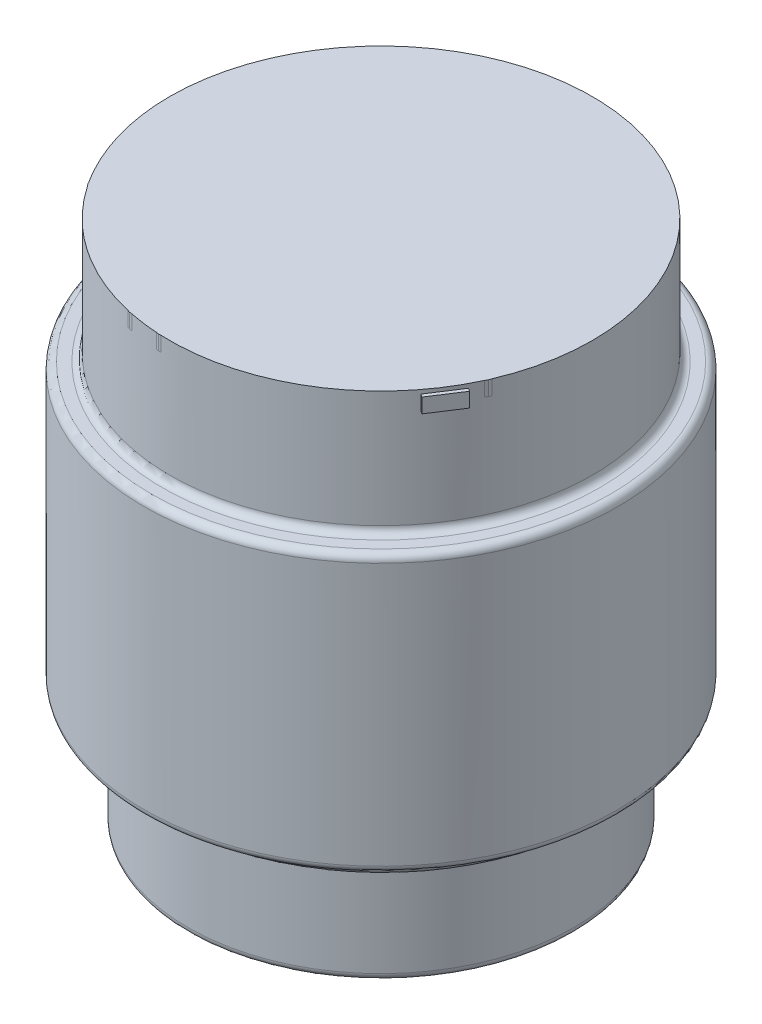
from build123d import *

# Parameters (mm, degrees)
BOSS_EXTRUDE4_DEPTH = 2
FILLET6_R           = 1
FILLET7_R           = 1


with BuildPart() as part:
    # Sketch10 → Revolve-Thin6 (revolve)
    with BuildSketch(Plane.XY, mode=Mode.PRIVATE) as revolve_thin6_sk:
        Polygon((0, 6.496951367), (29, 6.496951367), (29, -10.503048633), (32.5, -10.503048633), (32.5, -48.503048633), (30, -48.503048633), (30, -50.503048633), (26.5, -50.503048633), (26.5, -65.503048633), (0, -65.503048633), (0, -55.503048633), (16.5, -55.503048633), (16.5, -40.503048633), (20, -40.503048633), (20, -38.503048633), (22.5, -38.503048633), (22.5, -20.503048633), (19, -20.503048633), (19, -3.503048633), (0, -3.503048633), align=None)
    revolve(revolve_thin6_sk.sketch.rotate(Axis((0, 6.496951367, 0), (0, -1, 0)), 180), axis=Axis((0, 6.496951367, 0), (0, -1, 0)))

    # Sketch11 → Boss-Extrude4 (add)
    # profile 1 of 17: a face of its own
    with BuildSketch(Plane(origin=(0, 6.496951367, 0), x_dir=(1, 0, 0), z_dir=(0, 1, 0))):
        with BuildLine():
            Line((-28.957681113, -0.532634273), (-23.727650336, -0.121119574))
            Line((-23.727650336, -0.121119574), (-23.676575817, -0.774873421))
            Line((-23.676575817, -0.774873421), (-24.419345255, -0.833244301))
            add(Edge.make_bspline(
                [(-24.419345255, -0.833244301), (-24.347458268, -0.868124694), (-24.208276372, -0.935657353), (-24.019720789, -1.060296367), (-23.858401964, -1.201963839), (-23.723445217, -1.358733852), (-23.613134348, -1.530208931), (-23.531771043, -1.717095845), (-23.474722199, -1.918489433), (-23.458634658, -2.058679701), (-23.45038866, -2.130537091)],
                knots=[0, 0, 0, 0, 1.122070881, 2.172464881, 3.165406667, 4.130083354, 5.070697886, 6.019548718, 6.984879185, 8, 8, 8, 8], degree=3))
            add(Edge.make_bspline(
                [(-23.45038866, -2.130537091), (-23.447617405, -2.187461573), (-23.442162047, -2.299520383), (-23.456671681, -2.465257338), (-23.484753308, -2.626195577), (-23.533725182, -2.779164234), (-23.594319148, -2.923543369), (-23.667725352, -3.056509777), (-23.753649104, -3.175856004), (-23.851508052, -3.283307733), (-23.964295992, -3.37806856), (-24.094363282, -3.460985401), (-24.240553005, -3.535793448), (-24.376340765, -3.587421592), (-24.496622371, -3.623403309), (-24.59979189, -3.649823706), (-24.714592251, -3.674614535), (-24.84228026, -3.696025746), (-24.981461665, -3.716219029), (-25.13276416, -3.73518713), (-25.295674109, -3.753025938), (-25.408702825, -3.761831381), (-25.467102536, -3.766380981)],
                knots=[0, 0, 0, 0, 1.148046011, 2.259988374, 3.347033514, 4.436024228, 5.490905377, 6.50081764, 7.491734499, 8.449821394, 9.424436832, 10.452900198, 11.554016567, 12.730826635, 13.376294553, 14.085271799, 14.877932457, 15.743918541, 16.695556315, 17.713912727, 18.818823728, 20, 20, 20, 20], degree=3))
            Line((-25.467102536, -3.766380981), (-28.68333798, -4.018835033))
            Line((-28.68333798, -4.018835033), (-28.74170886, -3.290658315))
            Line((-28.74170886, -3.290658315), (-25.560495943, -3.039663534))
            add(Edge.make_bspline(
                [(-25.560495943, -3.039663534), (-25.470882011, -3.031425764), (-25.304250198, -3.016108118), (-25.074952999, -2.980446954), (-24.885153557, -2.936547585), (-24.730338419, -2.882819593), (-24.604729904, -2.813829942), (-24.496731112, -2.736182256), (-24.408420301, -2.641630597), (-24.334762754, -2.538047074), (-24.278539771, -2.423912271), (-24.244262473, -2.300708132), (-24.225436231, -2.17145415), (-24.229189445, -2.083404639), (-24.231099169, -2.038602956)],
                knots=[0, 0, 0, 0, 1.709897918, 3.179454152, 4.405848744, 5.40882994, 6.281571251, 7.120924061, 7.925132213, 8.727851484, 9.529878548, 10.328542577, 11.149522752, 12, 12, 12, 12], degree=3))
            add(Edge.make_bspline(
                [(-24.231099169, -2.038602956), (-24.235555063, -1.996148523), (-24.244287979, -1.912943884), (-24.272268245, -1.792987509), (-24.311899035, -1.680888821), (-24.363170897, -1.57642722), (-24.426583712, -1.479996193), (-24.499959173, -1.389496534), (-24.586522881, -1.307925031), (-24.685331275, -1.234366405), (-24.797842059, -1.168932068), (-24.927322265, -1.11518988), (-25.073366562, -1.073664677), (-25.235612364, -1.043558796), (-25.414058166, -1.023070965), (-25.60953906, -1.015595477), (-25.82143582, -1.01638012), (-25.96766739, -1.026471223), (-26.043514968, -1.03170529)],
                knots=[0, 0, 0, 0, 0.870478611, 1.706014023, 2.506619552, 3.292379936, 4.074306248, 4.857240034, 5.664708371, 6.494563828, 7.366286708, 8.313887945, 9.34743346, 10.459065403, 11.678042666, 13.009522691, 14.4488954, 16, 16, 16, 16], degree=3))
            Line((-26.043514968, -1.03170529), (-28.900769505, -1.256433175))
            Line((-28.900769505, -1.256433175), (-28.957681113, -0.532634273))
        make_face()
    # profile 2 of 17: a face of its own
    with BuildSketch(Plane(origin=(0, 6.496951367, 0), x_dir=(1, 0, 0), z_dir=(0, 1, 0))):
        Polygon((-22.453978986, -3.908394348), (-21.452918408, -3.714311175), (-21.315746842, -4.424976629), (-22.31680742, -4.619059802), align=None)
    # profile 3 of 17: a face of its own
    with BuildSketch(Plane(origin=(0, 6.496951367, 0), x_dir=(1, 0, 0), z_dir=(0, 1, 0))):
        Polygon((-28.539143143, -5.078730476), (-23.405424317, -4.090803346), (-23.268252751, -4.8014688), (-28.401971577, -5.78939593), align=None)
    # profile 4 of 17: a face of its own
    with BuildSketch(Plane(origin=(0, 6.496951367, 0), x_dir=(1, 0, 0), z_dir=(0, 1, 0))):
        Polygon((-28.12835516, -6.916015215), (-21.242050686, -4.836552644), (-21.033374793, -5.52678829), (-24.960275691, -6.71317641), (-22.435735166, -7.743422428), (-22.164310577, -8.640874696), (-24.48747157, -7.635436301), (-27.105405502, -10.301526209), (-27.36223737, -9.452229917), (-25.221485376, -7.323152098), (-25.942365734, -7.009408622), (-27.919679267, -7.606250862), align=None)
    # profile 5 of 17: a face of its own
    with BuildSketch(Plane(origin=(0, 6.496951367, 0), x_dir=(1, 0, 0), z_dir=(0, 1, 0))):
        Polygon((-26.869487414, -10.820804792), (-20.317356224, -7.778222713), (-20.01236838, -8.434895104), (-23.749563921, -10.169969488), (-21.092229645, -10.838316055), (-20.696766938, -11.691990164), (-23.146884593, -11.020725053), (-25.373733634, -14.042877323), (-25.748766533, -13.234440647), (-23.921758014, -10.816426976), (-24.683497988, -10.604832538), (-26.56449957, -11.477477183), align=None)
    # profile 6 of 17: a face of its own
    with BuildSketch(Plane(origin=(0, 6.496951367, 0), x_dir=(1, 0, 0), z_dir=(0, 1, 0))):
        with BuildLine():
            add(Edge.make_bspline(
                [(-23.049394948, -12.819651907), (-22.957207269, -12.760566839), (-22.778315034, -12.645910954), (-22.506409131, -12.498932132), (-22.242850071, -12.37587258), (-21.986040202, -12.281070562), (-21.736970357, -12.210509389), (-21.495185768, -12.170061136), (-21.261019124, -12.152538824), (-21.034825435, -12.163006115), (-20.819037221, -12.197148296), (-20.614562749, -12.248759077), (-20.423710347, -12.322991577), (-20.243692141, -12.414272055), (-20.07909054, -12.529660901), (-19.925515825, -12.661670815), (-19.785569867, -12.814735974), (-19.704982944, -12.929128487), (-19.663883954, -12.987468184)],
                knots=[0, 0, 0, 0, 1.377928271, 2.67390037, 3.887587296, 5.036398565, 6.116374832, 7.141129695, 8.117029299, 9.067076788, 9.984172926, 10.863365319, 11.716214135, 12.556953573, 13.397693011, 14.239836003, 15.102323811, 16, 16, 16, 16], degree=3))
            add(Edge.make_bspline(
                [(-19.663883954, -12.987468184), (-19.627054489, -13.047053668), (-19.55448975, -13.164454374), (-19.469747432, -13.351044815), (-19.407567119, -13.541896523), (-19.369774411, -13.737980118), (-19.353414617, -13.938155013), (-19.361086115, -14.14332841), (-19.39282937, -14.352368052), (-19.444672757, -14.565497685), (-19.521996301, -14.778049965), (-19.625320298, -14.987724076), (-19.756402891, -15.191599065), (-19.911485215, -15.391976792), (-20.093079628, -15.587295013), (-20.300294602, -15.777552452), (-20.533715297, -15.963844694), (-20.702130719, -16.079732336), (-20.78898265, -16.139495661)],
                knots=[0, 0, 0, 0, 0.894306785, 1.762044052, 2.611129252, 3.453385758, 4.307596222, 5.172055421, 6.070348654, 7.004932772, 7.970277812, 8.954230234, 9.985283289, 11.061861841, 12.187775178, 13.38851473, 14.653255514, 16, 16, 16, 16], degree=3))
            add(Edge.make_bspline(
                [(-20.78898265, -16.139495661), (-20.884556491, -16.201034867), (-21.069654471, -16.320217925), (-21.350262956, -16.473179399), (-21.621403855, -16.60043503), (-21.883976553, -16.699538477), (-22.137577196, -16.775081471), (-22.383422148, -16.818444197), (-22.620070007, -16.836995438), (-22.846902509, -16.828791557), (-23.062134127, -16.793852957), (-23.266053276, -16.74238758), (-23.457498734, -16.668704137), (-23.636037511, -16.574916465), (-23.802658301, -16.462016403), (-23.955076037, -16.327412506), (-24.09629038, -16.174284437), (-24.177206663, -16.05924667), (-24.218271804, -16.000864823)],
                knots=[0, 0, 0, 0, 1.410864862, 2.7324238, 3.96446408, 5.126475298, 6.213990734, 7.244600286, 8.219584348, 9.156338201, 10.054879087, 10.922003448, 11.763145832, 12.595133244, 13.420916799, 14.255464616, 15.114645557, 16, 16, 16, 16], degree=3))
            add(Edge.make_bspline(
                [(-24.218271804, -16.000864823), (-24.255829205, -15.940904779), (-24.329377987, -15.82348483), (-24.411893658, -15.634754606), (-24.476631504, -15.443832307), (-24.513293917, -15.246875369), (-24.530959252, -15.046250128), (-24.520073317, -14.841777167), (-24.491671277, -14.632231593), (-24.437138857, -14.419893274), (-24.358345134, -14.206271701), (-24.252588786, -13.995103382), (-24.118564099, -13.788502311), (-23.956414366, -13.586960444), (-23.768673974, -13.38831778), (-23.554941515, -13.192363914), (-23.313335499, -13.00121167), (-23.139141143, -12.881386634), (-23.049394948, -12.819651907)],
                knots=[0, 0, 0, 0, 0.890528789, 1.743925415, 2.589179939, 3.425988632, 4.262460414, 5.121519344, 6.00064356, 6.923992462, 7.87830598, 8.865298687, 9.894092142, 10.975983473, 12.120928627, 13.335821418, 14.627395881, 16, 16, 16, 16], degree=3))
        make_face()
        with BuildLine():
            add(Edge.make_bspline(
                [(-22.639339521, -13.439842498), (-22.706978311, -13.485823378), (-22.837713804, -13.574697427), (-23.019414664, -13.715553985), (-23.182026023, -13.856496285), (-23.323978222, -13.99946743), (-23.445690424, -14.143101102), (-23.549469478, -14.286082798), (-23.631262613, -14.431350152), (-23.695070935, -14.575944669), (-23.737912287, -14.720008536), (-23.768438087, -14.859399979), (-23.78025135, -14.995722519), (-23.775567425, -15.127889207), (-23.757057468, -15.256901947), (-23.72190084, -15.382263748), (-23.668844335, -15.502573517), (-23.6227997, -15.577678246), (-23.599540484, -15.615617021)],
                knots=[0, 0, 0, 0, 1.476279224, 2.853423223, 4.147953738, 5.358852271, 6.486652708, 7.544264598, 8.543112169, 9.490974778, 10.391010581, 11.252162267, 12.063134575, 12.853933517, 13.635116927, 14.410752231, 15.197199508, 16, 16, 16, 16], degree=3))
            add(Edge.make_bspline(
                [(-23.599540484, -15.615617021), (-23.575175573, -15.64994561), (-23.52708069, -15.7177082), (-23.439079227, -15.805501432), (-23.342471145, -15.882880666), (-23.233442064, -15.944814612), (-23.11528413, -15.996784586), (-22.986059793, -16.036208766), (-22.846026158, -16.061820687), (-22.696567058, -16.074806071), (-22.538483787, -16.074155132), (-22.372899861, -16.05223749), (-22.200272418, -16.01456881), (-22.02165848, -15.956210551), (-21.83607465, -15.881316049), (-21.643278274, -15.789268125), (-21.444166668, -15.677737613), (-21.312396353, -15.592536589), (-21.244275508, -15.548490509)],
                knots=[0, 0, 0, 0, 0.76969777, 1.51933754, 2.267864889, 3.03031097, 3.808213611, 4.62823263, 5.498353348, 6.410552238, 7.372713114, 8.387071871, 9.463491849, 10.604512329, 11.823710242, 13.126700497, 14.514600267, 16, 16, 16, 16], degree=3))
            add(Edge.make_bspline(
                [(-21.244275508, -15.548490509), (-21.177175336, -15.502436421), (-21.047174114, -15.413210303), (-20.865582534, -15.272874389), (-20.703482439, -15.131865735), (-20.561275752, -14.990257237), (-20.438772014, -14.848491955), (-20.337295715, -14.704654801), (-20.255184679, -14.559968074), (-20.19146568, -14.415289539), (-20.148684021, -14.271250223), (-20.117754432, -14.131365618), (-20.107060416, -13.994607042), (-20.108329265, -13.862185409), (-20.130323294, -13.734056985), (-20.164390107, -13.608935898), (-20.218088799, -13.488400513), (-20.26379644, -13.412629224), (-20.286993089, -13.374175259)],
                knots=[0, 0, 0, 0, 1.47058857, 2.849147881, 4.145008804, 5.35091982, 6.473185514, 7.526799061, 8.526673163, 9.475509904, 10.376470686, 11.238507391, 12.059071255, 12.850438821, 13.625077647, 14.401510082, 15.188765603, 16, 16, 16, 16], degree=3))
            add(Edge.make_bspline(
                [(-20.286993089, -13.374175259), (-20.311341807, -13.339823506), (-20.359803255, -13.271452936), (-20.44888334, -13.183410924), (-20.544996064, -13.103816145), (-20.65462343, -13.042153446), (-20.772684795, -12.990044717), (-20.901494296, -12.950888279), (-21.040960811, -12.924887667), (-21.189972497, -12.912115593), (-21.347567535, -12.912654939), (-21.512191831, -12.934623993), (-21.683784536, -12.972518749), (-21.861916671, -13.030732718), (-22.047924941, -13.105248097), (-22.239927671, -13.199428089), (-22.439510741, -13.310466083), (-22.571239934, -13.395752351), (-22.639339521, -13.439842498)],
                knots=[0, 0, 0, 0, 0.769904061, 1.532346229, 2.286621382, 3.049271811, 3.827382942, 4.647621739, 5.50921895, 6.421662323, 7.384081074, 8.389869001, 9.457877035, 10.599203326, 11.818728004, 13.125930407, 14.514202156, 16, 16, 16, 16], degree=3))
        make_face(mode=Mode.SUBTRACT)
    # profile 7 of 17: a face of its own
    with BuildSketch(Plane(origin=(0, 6.496951367, 0), x_dir=(1, 0, 0), z_dir=(0, 1, 0))):
        with BuildLine():
            Line((-22.503680055, -18.260097003), (-18.533000998, -14.843941297))
            Line((-18.533000998, -14.843941297), (-18.103975036, -15.341553043))
            Line((-18.103975036, -15.341553043), (-18.705195091, -15.859594596))
            add(Edge.make_bspline(
                [(-18.705195091, -15.859594596), (-18.658597984, -15.846092766), (-18.568709499, -15.820046964), (-18.437534356, -15.788430611), (-18.316387692, -15.762219898), (-18.20526771, -15.740333885), (-18.103189936, -15.729374254), (-18.010699068, -15.72319228), (-17.927693014, -15.722230369), (-17.830946816, -15.732242172), (-17.721544017, -15.757387242), (-17.601883803, -15.807914135), (-17.494765808, -15.878226076), (-17.436014279, -15.939605383), (-17.406443029, -15.970499266)],
                knots=[0, 0, 0, 0, 1.261029181, 2.432597441, 3.506539149, 4.483737313, 5.374657151, 6.172903435, 6.893674923, 7.529084029, 8.697714225, 9.796893971, 10.891116522, 12, 12, 12, 12], degree=3))
            add(Edge.make_bspline(
                [(-17.406443029, -15.970499266), (-17.368796023, -16.019288007), (-17.291513671, -16.119442283), (-17.213743933, -16.300125265), (-17.15824716, -16.502554844), (-17.144905533, -16.64672298), (-17.137936985, -16.722024336)],
                knots=[0, 0, 0, 0, 0.907858786, 1.863666438, 2.884158329, 4, 4, 4, 4], degree=3))
            Line((-17.137936985, -16.722024336), (-17.92302531, -17.072249611))
            add(Edge.make_bspline(
                [(-17.92302531, -17.072249611), (-17.929902794, -17.019445012), (-17.943070865, -16.918341952), (-17.984200256, -16.77660516), (-18.041709062, -16.651363559), (-18.095368004, -16.581108226), (-18.121486299, -16.546911698)],
                knots=[0, 0, 0, 0, 1.119608421, 2.14367383, 3.096439983, 4, 4, 4, 4], degree=3))
            add(Edge.make_bspline(
                [(-18.121486299, -16.546911698), (-18.14769108, -16.518975893), (-18.199914964, -16.463302226), (-18.297200478, -16.400634675), (-18.405296089, -16.354787471), (-18.523776935, -16.327517991), (-18.649366875, -16.318758256), (-18.779466176, -16.330730428), (-18.912197478, -16.364961391), (-18.997990281, -16.402191576), (-19.042286919, -16.421414308)],
                knots=[0, 0, 0, 0, 0.915944099, 1.825398144, 2.750881659, 3.721747369, 4.72774328, 5.758872911, 6.842858727, 8, 8, 8, 8], degree=3))
            add(Edge.make_bspline(
                [(-19.042286919, -16.421414308), (-19.121171209, -16.461229715), (-19.28036575, -16.541580257), (-19.510968257, -16.682623874), (-19.736303002, -16.841489957), (-19.879204294, -16.959888281), (-19.951413362, -17.01971582)],
                knots=[0, 0, 0, 0, 0.971274388, 1.960106118, 2.969226699, 4, 4, 4, 4], degree=3))
            Line((-19.951413362, -17.01971582), (-22.030875934, -18.808783267))
            Line((-22.030875934, -18.808783267), (-22.503680055, -18.260097003))
        make_face()
    # profile 8 of 17: a face of its own
    with BuildSketch(Plane(origin=(0, 6.496951367, 0), x_dir=(1, 0, 0), z_dir=(0, 1, 0))):
        Polygon((-19.423254639, -21.535299467), (-13.268045428, -17.080142112), (-12.589483957, -17.585050217), (-14.960800924, -24.850765406), (-15.683140555, -24.315212589), (-14.928696941, -22.140897339), (-16.920603194, -20.661195551), (-18.753448801, -22.032911212), align=None)
        with BuildLine():
            Line((-16.272686434, -20.169420894), (-14.657272353, -21.368942462))
            Line((-14.657272353, -21.368942462), (-13.95536253, -19.390169657))
            add(Edge.make_bspline(
                [(-13.95536253, -19.390169657), (-13.929241263, -19.315694703), (-13.878471588, -19.170944103), (-13.801809057, -18.960114576), (-13.729612485, -18.76021359), (-13.658114725, -18.572617163), (-13.589049242, -18.396713057), (-13.523602153, -18.232213632), (-13.46137497, -18.078548598), (-13.418566763, -17.980907775), (-13.397920634, -17.93381622)],
                knots=[0, 0, 0, 0, 1.21438178, 2.360290057, 3.451842455, 4.484668862, 5.449258951, 6.359620403, 7.208855247, 8, 8, 8, 8], degree=3))
            add(Edge.make_bspline(
                [(-13.397920634, -17.93381622), (-13.482914341, -18.014752688), (-13.653547696, -18.177240729), (-13.921235372, -18.409178258), (-14.195357325, -18.63711016), (-14.385280861, -18.780910676), (-14.480700443, -18.853157568)],
                knots=[0, 0, 0, 0, 0.990747883, 1.989025307, 2.989665162, 4, 4, 4, 4], degree=3))
            Line((-14.480700443, -18.853157568), (-16.272686434, -20.169420894))
        make_face(mode=Mode.SUBTRACT)
    # profile 9 of 17: a face of its own
    with BuildSketch(Plane(origin=(0, 6.496951367, 0), x_dir=(1, 0, 0), z_dir=(0, 1, 0))):
        Polygon((-14.375966207, -25.126353217), (-11.185997658, -18.641348538), (-7.597647859, -20.407067634), (-7.97414003, -21.173185423), (-10.859120735, -19.753313787), (-11.847047865, -21.761272031), (-9.35169278, -22.988519766), (-9.72818495, -23.753178284), (-12.223540036, -22.525930549), (-13.672597112, -25.472200676), align=None)
    # profile 10 of 17: a face of its own
    with BuildSketch(Plane(origin=(0, 6.496951367, 0), x_dir=(1, 0, 0), z_dir=(0, 1, 0))):
        with BuildLine():
            Line((-7.549456327, -26.008970702), (-6.784797809, -26.090689933))
            add(Edge.make_bspline(
                [(-6.784797809, -26.090689933), (-6.788324413, -26.147090737), (-6.795190746, -26.256903663), (-6.795119602, -26.417218266), (-6.786481707, -26.568264847), (-6.769870248, -26.709923589), (-6.741705639, -26.842045139), (-6.705406648, -26.965132501), (-6.660533068, -27.079220597), (-6.606430009, -27.183242077), (-6.544456813, -27.276915355), (-6.47784577, -27.362160363), (-6.404031653, -27.436462863), (-6.326831327, -27.503191523), (-6.24326997, -27.55863865), (-6.154539349, -27.604118982), (-6.060964882, -27.641599623), (-5.99509169, -27.65730136), (-5.961768413, -27.665244399)],
                knots=[0, 0, 0, 0, 1.389716794, 2.705792356, 3.940206737, 5.109593109, 6.210115764, 7.258684784, 8.262904256, 9.220797597, 10.136674164, 11.022357389, 11.876864736, 12.708707921, 13.528329561, 14.336342241, 15.158405313, 16, 16, 16, 16], degree=3))
            add(Edge.make_bspline(
                [(-5.961768413, -27.665244399), (-5.919569989, -27.672562734), (-5.836570537, -27.686957058), (-5.710527266, -27.691211138), (-5.58592105, -27.679640989), (-5.462680676, -27.651119372), (-5.340525818, -27.608727568), (-5.220224289, -27.549615288), (-5.102062397, -27.474364009), (-4.98548792, -27.385499286), (-4.873320355, -27.283043154), (-4.771210743, -27.164442322), (-4.675241205, -27.034718455), (-4.591944396, -26.890066471), (-4.516420176, -26.733640418), (-4.451493493, -26.564042092), (-4.394129536, -26.381325309), (-4.364484527, -26.253864652), (-4.349272875, -26.188461155)],
                knots=[0, 0, 0, 0, 0.844313363, 1.660667415, 2.480118955, 3.306734256, 4.150611056, 5.026311028, 5.945033722, 6.910642073, 7.91593497, 8.936236463, 9.994042251, 11.095327271, 12.224369721, 13.418602001, 14.675415133, 16, 16, 16, 16], degree=3))
            add(Edge.make_bspline(
                [(-4.349272875, -26.188461155), (-4.337291403, -26.126822512), (-4.313910075, -26.00653734), (-4.293057302, -25.829014191), (-4.287878474, -25.659252684), (-4.292145234, -25.498058476), (-4.313232855, -25.344711214), (-4.346389685, -25.199937647), (-4.393077063, -25.063319331), (-4.453208, -24.936604504), (-4.523333937, -24.819105698), (-4.603129543, -24.71295209), (-4.691517194, -24.618902988), (-4.787074946, -24.535530352), (-4.892651095, -24.466160711), (-5.005592705, -24.406680979), (-5.128085252, -24.361573193), (-5.21342528, -24.340231006), (-5.256940046, -24.329348653)],
                knots=[0, 0, 0, 0, 1.297623625, 2.532256924, 3.68916195, 4.805876302, 5.860919924, 6.882770692, 7.871592211, 8.838551481, 9.776538345, 10.695472832, 11.57747539, 12.440067982, 13.310069946, 14.182450474, 15.073233932, 16, 16, 16, 16], degree=3))
            add(Edge.make_bspline(
                [(-5.256940046, -24.329348653), (-5.310769625, -24.320622092), (-5.417943909, -24.303247575), (-5.581601319, -24.302698122), (-5.744205138, -24.331218678), (-5.904978362, -24.37825394), (-6.060523688, -24.448514024), (-6.205368539, -24.541456556), (-6.340573989, -24.654312439), (-6.417337566, -24.74450845), (-6.456461614, -24.790478598)],
                knots=[0, 0, 0, 0, 0.966538294, 1.924370427, 2.886197827, 3.885463141, 4.889560341, 5.902149781, 6.93078991, 8, 8, 8, 8], degree=3))
            Line((-6.456461614, -24.790478598), (-7.105837645, -24.54094309))
            Line((-7.105837645, -24.54094309), (-5.767685239, -21.022638346))
            Line((-5.767685239, -21.022638346), (-2.882704535, -21.635532577))
            Line((-2.882704535, -21.635532577), (-3.059276444, -22.467317606))
            Line((-3.059276444, -22.467317606), (-5.373681805, -21.975542949))
            Line((-5.373681805, -21.975542949), (-6.093102891, -23.812766372))
            add(Edge.make_bspline(
                [(-6.093102891, -23.812766372), (-6.042485052, -23.786012957), (-5.94359802, -23.733747476), (-5.790474591, -23.673263946), (-5.640163231, -23.624153173), (-5.490215997, -23.590052563), (-5.341134983, -23.571645316), (-5.193127422, -23.564667524), (-5.045939703, -23.57537641), (-4.949395731, -23.592544256), (-4.900877683, -23.601171935)],
                knots=[0, 0, 0, 0, 1.109711602, 2.167933055, 3.188383805, 4.174903852, 5.145045965, 6.098715562, 7.044511978, 8, 8, 8, 8], degree=3))
            add(Edge.make_bspline(
                [(-4.900877683, -23.601171935), (-4.841112516, -23.615833132), (-4.72339056, -23.644711907), (-4.555019317, -23.711971633), (-4.396986273, -23.796789821), (-4.248746132, -23.899717777), (-4.110439777, -24.02030073), (-3.983024832, -24.160047523), (-3.866547855, -24.318501956), (-3.760689184, -24.492614018), (-3.668217871, -24.680543672), (-3.595483187, -24.880644277), (-3.542716331, -25.090418967), (-3.51095045, -25.309962635), (-3.498237363, -25.539431071), (-3.504262974, -25.779027616), (-3.530397853, -26.028468288), (-3.563344438, -26.195972945), (-3.580236541, -26.281854562)],
                knots=[0, 0, 0, 0, 0.885958152, 1.745108926, 2.604459864, 3.465895466, 4.340324882, 5.243341007, 6.185505916, 7.170134635, 8.176507593, 9.198843226, 10.23255549, 11.288374201, 12.390755966, 13.540743016, 14.739109881, 16, 16, 16, 16], degree=3))
            add(Edge.make_bspline(
                [(-3.580236541, -26.281854562), (-3.599920952, -26.366818036), (-3.638533837, -26.533482152), (-3.716704443, -26.774514236), (-3.81035303, -27.001846849), (-3.916846015, -27.218140959), (-4.039267046, -27.420817079), (-4.177508482, -27.610698567), (-4.331010609, -27.786713942), (-4.49611211, -27.95018859), (-4.672274957, -28.094053472), (-4.857062126, -28.213543909), (-5.048713366, -28.306609661), (-5.247209081, -28.374232359), (-5.452549967, -28.417067306), (-5.664843398, -28.432740818), (-5.883438382, -28.422791111), (-6.029113245, -28.396565261), (-6.103317795, -28.383206213)],
                knots=[0, 0, 0, 0, 1.141716525, 2.239587989, 3.313677372, 4.359166192, 5.393711269, 6.410453499, 7.43096009, 8.448958653, 9.449772452, 10.403927852, 11.324139102, 12.232634786, 13.143360897, 14.06330754, 15.013478442, 16, 16, 16, 16], degree=3))
            add(Edge.make_bspline(
                [(-6.103317795, -28.383206213), (-6.164893665, -28.368191808), (-6.285682582, -28.338739138), (-6.459308707, -28.277509269), (-6.62094638, -28.198848117), (-6.772989452, -28.107361959), (-6.914482887, -28.000325296), (-7.042529931, -27.876480414), (-7.162103741, -27.739964576), (-7.269307192, -27.588992643), (-7.36282351, -27.425338414), (-7.440449255, -27.251429693), (-7.500331369, -27.067396538), (-7.543926537, -26.87393627), (-7.571896343, -26.670851271), (-7.581015974, -26.458031725), (-7.576174202, -26.235979506), (-7.558490384, -26.08572869), (-7.549456327, -26.008970702)],
                knots=[0, 0, 0, 0, 0.985373597, 1.932935911, 2.856672714, 3.776560079, 4.688950784, 5.609304663, 6.542319599, 7.507950578, 8.483840089, 9.469358883, 10.464586317, 11.488666898, 12.550016846, 13.648257402, 14.798575372, 16, 16, 16, 16], degree=3))
        make_face()
    # profile 11 of 17: a face of its own
    with BuildSketch(Plane(origin=(0, 6.496951367, 0), x_dir=(1, 0, 0), z_dir=(0, 1, 0))):
        with BuildLine():
            add(Edge.make_bspline(
                [(-3.28036277, -25.207247774), (-3.271420682, -25.060244499), (-3.254098633, -24.775479014), (-3.208089951, -24.363223145), (-3.150574873, -23.979434209), (-3.079718323, -23.623593442), (-2.994211071, -23.295852508), (-2.893818792, -22.996461265), (-2.780965805, -22.724777991), (-2.65195478, -22.482720676), (-2.51127144, -22.268421773), (-2.356240147, -22.083680811), (-2.186379378, -21.930989604), (-2.006331175, -21.803535543), (-1.809550651, -21.712007508), (-1.601055169, -21.647890946), (-1.378976249, -21.615576756), (-1.227250927, -21.617775804), (-1.149825679, -21.618897975)],
                knots=[0, 0, 0, 0, 1.520305974, 2.945040957, 4.28101538, 5.52592424, 6.689219096, 7.77548106, 8.783752872, 9.722866669, 10.603150165, 11.426221928, 12.204890916, 12.955742736, 13.694813101, 14.435110933, 15.201439006, 16, 16, 16, 16], degree=3))
            add(Edge.make_bspline(
                [(-1.149825679, -21.618897975), (-1.081007877, -21.625020152), (-0.946434097, -21.63699212), (-0.751928889, -21.682735024), (-0.57012717, -21.7523918), (-0.399963209, -21.843945605), (-0.243712071, -21.961543939), (-0.099956232, -22.101114286), (0.030671263, -22.264407899), (0.104979247, -22.385606039), (0.143089295, -22.44776446)],
                knots=[0, 0, 0, 0, 1.030231069, 2.014625334, 2.970578811, 3.928927716, 4.888705518, 5.879610539, 6.912524073, 8, 8, 8, 8], degree=3))
            add(Edge.make_bspline(
                [(0.143089295, -22.44776446), (0.186888269, -22.531518754), (0.277806436, -22.705376408), (0.380331782, -22.995399601), (0.466726737, -23.316236458), (0.528866707, -23.67144044), (0.574646972, -24.058692059), (0.595670744, -24.479758204), (0.600988304, -24.93403527), (0.587735316, -25.247649232), (0.580870889, -25.410086579)],
                knots=[0, 0, 0, 0, 0.74755753, 1.551784301, 2.42906677, 3.376422243, 4.404042311, 5.51499853, 6.712885595, 8, 8, 8, 8], degree=3))
            add(Edge.make_bspline(
                [(0.580870889, -25.410086579), (0.571735454, -25.556097239), (0.554015541, -25.839312684), (0.510575232, -26.249358377), (0.452554932, -26.631694793), (0.380249252, -26.985898983), (0.294030469, -27.312818662), (0.196341896, -27.612491114), (0.082183875, -27.883680935), (-0.044226116, -28.126896543), (-0.18361439, -28.342210777), (-0.339576826, -28.525502039), (-0.506435394, -28.681849847), (-0.688945132, -28.805230159), (-0.884659431, -28.89890892), (-1.093717718, -28.961791065), (-1.316589752, -28.994594271), (-1.468824164, -28.992309509), (-1.546747658, -28.991140018)],
                knots=[0, 0, 0, 0, 1.512680884, 2.934132275, 4.262280189, 5.510166847, 6.670442744, 7.756832871, 8.766703294, 9.709401775, 10.588307448, 11.412684187, 12.192263278, 12.945616481, 13.681316024, 14.427600243, 15.195143325, 16, 16, 16, 16], degree=3))
            add(Edge.make_bspline(
                [(-1.546747658, -28.991140018), (-1.615639539, -28.985344515), (-1.751647058, -28.973902933), (-1.948768586, -28.922284188), (-2.135426651, -28.8479146), (-2.311187141, -28.747720275), (-2.473867485, -28.620122861), (-2.62643418, -28.469007132), (-2.766871989, -28.291577389), (-2.897912322, -28.088925461), (-3.015301376, -27.854261349), (-3.107349178, -27.582171418), (-3.185051187, -27.275377074), (-3.241722397, -26.932164889), (-3.280587633, -26.552540192), (-3.299816805, -26.13656101), (-3.301348918, -25.683746348), (-3.287538049, -25.370165254), (-3.28036277, -25.207247774)],
                knots=[0, 0, 0, 0, 0.714586358, 1.410748504, 2.099918283, 2.790099182, 3.497194162, 4.234279464, 5.008136091, 5.835044767, 6.72909973, 7.716527889, 8.802296067, 10.002699029, 11.314005512, 12.750902227, 14.311968316, 16, 16, 16, 16], degree=3))
        make_face()
        with BuildLine():
            add(Edge.make_bspline(
                [(-2.53613406, -25.246648118), (-2.542281552, -25.387200047), (-2.554062298, -25.656546771), (-2.558364473, -26.042944155), (-2.552236758, -26.393440317), (-2.532591536, -26.708114707), (-2.499574144, -26.987329718), (-2.455433929, -27.231372768), (-2.40011988, -27.440755543), (-2.329633592, -27.616473567), (-2.246376156, -27.762878442), (-2.161459008, -27.89181182), (-2.066081549, -28.000152781), (-1.964497953, -28.090145186), (-1.85701725, -28.16399008), (-1.740507806, -28.215707052), (-1.617934454, -28.252881022), (-1.532905353, -28.260542067), (-1.489836051, -28.264422572)],
                knots=[0, 0, 0, 0, 1.923735351, 3.686550698, 5.283306822, 6.716452595, 7.996106905, 9.125918507, 10.105437439, 10.952792877, 11.706111561, 12.405332234, 13.060483182, 13.673090606, 14.257911483, 14.835385408, 15.410094446, 16, 16, 16, 16], degree=3))
            add(Edge.make_bspline(
                [(-1.489836051, -28.264422572), (-1.448899982, -28.264783573), (-1.367830075, -28.265498499), (-1.247566776, -28.243028375), (-1.132851418, -28.198897871), (-1.02046229, -28.139620702), (-0.915091225, -28.056721685), (-0.812522043, -27.957225742), (-0.715050829, -27.837739728), (-0.619497302, -27.698464541), (-0.530513212, -27.530426264), (-0.453200123, -27.327263444), (-0.384214171, -27.088906758), (-0.323433387, -26.814913342), (-0.272227004, -26.50493457), (-0.226571858, -26.159017009), (-0.192855006, -25.77673658), (-0.176344363, -25.50984484), (-0.167735637, -25.370686236)],
                knots=[0, 0, 0, 0, 0.563801193, 1.116553505, 1.674938229, 2.254374546, 2.862325813, 3.517162998, 4.222513174, 4.985569308, 5.844058268, 6.838409481, 7.978579443, 9.264611633, 10.707499405, 12.311319874, 14.076704895, 16, 16, 16, 16], degree=3))
            add(Edge.make_bspline(
                [(-0.167735637, -25.370686236), (-0.161590205, -25.229647892), (-0.149832795, -24.959814042), (-0.145492621, -24.572930233), (-0.151669956, -24.221952023), (-0.17128984, -23.906300475), (-0.204176278, -23.626600728), (-0.248091666, -23.382310456), (-0.305536974, -23.17387822), (-0.375689691, -22.997970714), (-0.4585088, -22.851722199), (-0.544299781, -22.723839231), (-0.639820949, -22.615403145), (-0.741416306, -22.523956267), (-0.851804927, -22.452154643), (-0.969158853, -22.400052011), (-1.093739112, -22.362863136), (-1.180209766, -22.355302883), (-1.22424855, -22.351452509)],
                knots=[0, 0, 0, 0, 1.924779948, 3.682479291, 5.274601344, 6.710206324, 7.992731927, 9.112744264, 10.091197891, 10.936094152, 11.687226571, 12.378938799, 13.032188382, 13.652380101, 14.237386595, 14.819226386, 15.398641834, 16, 16, 16, 16], degree=3))
            add(Edge.make_bspline(
                [(-1.22424855, -22.351452509), (-1.264706297, -22.351073117), (-1.344827495, -22.35032178), (-1.464001879, -22.37315247), (-1.578049231, -22.416563783), (-1.689435797, -22.476779093), (-1.794492073, -22.558724286), (-1.896254539, -22.658831143), (-1.991059953, -22.780013139), (-2.087698329, -22.918354835), (-2.174378533, -23.087416289), (-2.25218365, -23.289997526), (-2.321596959, -23.528239198), (-2.379348172, -23.802816457), (-2.434310669, -24.112058252), (-2.476480874, -24.458497468), (-2.51125086, -24.840563814), (-2.527606272, -25.107477875), (-2.53613406, -25.246648118)],
                knots=[0, 0, 0, 0, 0.558046607, 1.105137234, 1.664477676, 2.238999019, 2.847990841, 3.499144479, 4.206660393, 4.971022556, 5.827849303, 6.823902424, 7.966023875, 9.252800971, 10.699298812, 12.305006416, 14.073413029, 16, 16, 16, 16], degree=3))
        make_face(mode=Mode.SUBTRACT)
    # profile 12 of 17: a face of its own
    with BuildSketch(Plane(origin=(0, 6.496951367, 0), x_dir=(1, 0, 0), z_dir=(0, 1, 0))):
        with BuildLine():
            Line((1.305780503, -28.911007783), (0.549877617, -23.729132982))
            Line((0.549877617, -23.729132982), (1.193416561, -23.635739575))
            Line((1.193416561, -23.635739575), (1.299943415, -24.362457021))
            add(Edge.make_bspline(
                [(1.299943415, -24.362457021), (1.326823782, -24.292552056), (1.379462938, -24.155658896), (1.487567711, -23.968563163), (1.612319967, -23.801288367), (1.755600984, -23.656163789), (1.914974341, -23.535517295), (2.085630349, -23.436906149), (2.270144904, -23.367093779), (2.399264679, -23.342942795), (2.464442455, -23.330751731)],
                knots=[0, 0, 0, 0, 1.096434618, 2.147120741, 3.155358421, 4.148634333, 5.125523326, 6.077156172, 7.029376527, 8, 8, 8, 8], degree=3))
            add(Edge.make_bspline(
                [(2.464442455, -23.330751731), (2.536817533, -23.322616631), (2.677632213, -23.306788785), (2.885435276, -23.321819499), (3.079666469, -23.368988441), (3.259826593, -23.446744066), (3.423598982, -23.556390509), (3.569760183, -23.696175249), (3.698723747, -23.86580758), (3.764276025, -23.995931809), (3.798217045, -24.063306265)],
                knots=[0, 0, 0, 0, 1.060482191, 2.063299473, 3.01998643, 3.963642937, 4.910068801, 5.878572319, 6.901587834, 8, 8, 8, 8], degree=3))
            add(Edge.make_bspline(
                [(3.798217045, -24.063306265), (3.830160478, -23.985206733), (3.891639695, -23.834894207), (4.006820427, -23.629272296), (4.133101389, -23.448879704), (4.276108232, -23.297142026), (4.431982857, -23.171255918), (4.601101913, -23.072838369), (4.783457867, -22.999943436), (4.912037981, -22.976417089), (4.977308805, -22.964474464)],
                knots=[0, 0, 0, 0, 1.193254114, 2.296569945, 3.328156582, 4.302201224, 5.237598564, 6.153875678, 7.062856216, 8, 8, 8, 8], degree=3))
            add(Edge.make_bspline(
                [(4.977308805, -22.964474464), (5.026850105, -22.958747661), (5.124248617, -22.94748873), (5.268066694, -22.945648783), (5.405767411, -22.95954684), (5.537653772, -22.984246959), (5.662622121, -23.028598884), (5.782770712, -23.082507258), (5.894410159, -23.154979049), (6.001988374, -23.237704533), (6.102117074, -23.337409373), (6.190931049, -23.456352299), (6.272924729, -23.590322171), (6.343880261, -23.742640807), (6.40818199, -23.910739106), (6.4635516, -24.096518618), (6.507913087, -24.299694275), (6.531118285, -24.441140662), (6.54310764, -24.514221307)],
                knots=[0, 0, 0, 0, 0.954338251, 1.876235086, 2.746260816, 3.600902663, 4.437187232, 5.278742881, 6.115752897, 6.978171261, 7.873636817, 8.810414827, 9.81330637, 10.875402003, 12.021941179, 13.256318487, 14.582430972, 16, 16, 16, 16], degree=3))
            Line((6.54310764, -24.514221307), (7.062608464, -28.071926395))
            Line((7.062608464, -28.071926395), (6.346105922, -28.175534705))
            Line((6.346105922, -28.175534705), (5.870383257, -24.911143286))
            add(Edge.make_bspline(
                [(5.870383257, -24.911143286), (5.857122702, -24.82538845), (5.83260534, -24.666836846), (5.787027728, -24.451143488), (5.737057089, -24.276962767), (5.681573219, -24.139892718), (5.615439232, -24.032653331), (5.541970347, -23.943990803), (5.458117767, -23.869137769), (5.362159436, -23.813098711), (5.261179639, -23.770427722), (5.155184071, -23.745439516), (5.046337377, -23.735994953), (4.973389223, -23.743064377), (4.93644919, -23.746644246)],
                knots=[0, 0, 0, 0, 1.842649964, 3.406864494, 4.678331842, 5.687534637, 6.536193093, 7.343015864, 8.126282059, 8.909343862, 9.692064892, 10.446248057, 11.213199437, 12, 12, 12, 12], degree=3))
            add(Edge.make_bspline(
                [(4.93644919, -23.746644246), (4.898780176, -23.753003675), (4.824816931, -23.765490438), (4.719264648, -23.799929413), (4.620625926, -23.844196461), (4.52791913, -23.897453662), (4.444335161, -23.964764645), (4.366718585, -24.041084518), (4.294408936, -24.127158307), (4.231680554, -24.225947863), (4.177844337, -24.335513431), (4.133349506, -24.456566091), (4.101825494, -24.589838152), (4.082184851, -24.734986782), (4.071677865, -24.891527863), (4.074362884, -25.060160254), (4.085214914, -25.240529915), (4.101904946, -25.364086826), (4.110501249, -25.427725567)],
                knots=[0, 0, 0, 0, 0.867602914, 1.703541492, 2.515429914, 3.32346746, 4.126646412, 4.94782242, 5.796035111, 6.676512837, 7.601434753, 8.567115782, 9.602539756, 10.708341072, 11.894255652, 13.166166042, 14.540416544, 16, 16, 16, 16], degree=3))
            Line((4.110501249, -25.427725567), (4.549742115, -28.438203661))
            Line((4.549742115, -28.438203661), (3.828861757, -28.543271244))
            Line((3.828861757, -28.543271244), (3.337087099, -25.176730786))
            add(Edge.make_bspline(
                [(3.337087099, -25.176730786), (3.328631785, -25.125122775), (3.312387803, -25.025975707), (3.284085502, -24.883336672), (3.248334619, -24.754220527), (3.212014949, -24.636791159), (3.167373606, -24.533712547), (3.119341772, -24.442792589), (3.067862119, -24.36338596), (2.991953915, -24.278606508), (2.887110379, -24.194942541), (2.744220502, -24.12856235), (2.586561569, -24.097690619), (2.479079854, -24.107735136), (2.42358284, -24.112921513)],
                knots=[0, 0, 0, 0, 1.185556483, 2.277639617, 3.294066498, 4.221616317, 5.061380465, 5.835840284, 6.551468596, 7.199793975, 8.40870842, 9.563140593, 10.741754163, 12, 12, 12, 12], degree=3))
            add(Edge.make_bspline(
                [(2.42358284, -24.112921513), (2.383979315, -24.119802313), (2.306146835, -24.133325093), (2.194866797, -24.168671012), (2.09155417, -24.215838714), (1.996148243, -24.274255202), (1.909308576, -24.344940555), (1.831881612, -24.427288373), (1.762382222, -24.520790965), (1.700482282, -24.626426915), (1.648761299, -24.748223033), (1.609596943, -24.887910634), (1.585022799, -25.04662512), (1.568341123, -25.224012889), (1.566849898, -25.421024859), (1.575926719, -25.637211374), (1.596467214, -25.872394518), (1.618350104, -26.034864337), (1.629738883, -26.119420485)],
                knots=[0, 0, 0, 0, 0.791180923, 1.554901346, 2.292443223, 3.023796354, 3.752634075, 4.491482053, 5.244669566, 6.043416244, 6.897765426, 7.844156282, 8.893342379, 10.05760716, 11.351387603, 12.770763649, 14.319369173, 16, 16, 16, 16], degree=3))
            Line((1.629738883, -26.119420485), (2.022283045, -28.807399472))
            Line((2.022283045, -28.807399472), (1.305780503, -28.911007783))
        make_face()
    # profile 13 of 17: a face of its own
    with BuildSketch(Plane(origin=(0, 6.496951367, 0), x_dir=(1, 0, 0), z_dir=(0, 1, 0))):
        with BuildLine():
            Line((8.096205226, -27.785156629), (6.140780772, -22.941832927))
            Line((6.140780772, -22.941832927), (6.742000828, -22.699593779))
            Line((6.742000828, -22.699593779), (7.01634396, -23.379614522))
            add(Edge.make_bspline(
                [(7.01634396, -23.379614522), (7.026218884, -23.305344223), (7.045560805, -23.159871681), (7.104419545, -22.951728899), (7.1869378, -22.760258468), (7.290302541, -22.585128582), (7.416381253, -22.430965896), (7.55884132, -22.295755523), (7.721174256, -22.184644133), (7.84041664, -22.130239161), (7.90066278, -22.102751539)],
                knots=[0, 0, 0, 0, 1.099043919, 2.152687092, 3.16363717, 4.153323181, 5.128209411, 6.078131782, 7.028993407, 8, 8, 8, 8], degree=3))
            add(Edge.make_bspline(
                [(7.90066278, -22.102751539), (7.969144495, -22.078344503), (8.102342084, -22.030872584), (8.30681276, -21.995187676), (8.506296171, -21.99476329), (8.699115205, -22.02915332), (8.885029691, -22.094608547), (9.059395865, -22.19678538), (9.223751746, -22.330612528), (9.31737066, -22.44109471), (9.365771848, -22.498214246)],
                knots=[0, 0, 0, 0, 1.061925954, 2.065456143, 3.018782149, 3.965020526, 4.916885373, 5.885799271, 6.906953484, 8, 8, 8, 8], degree=3))
            add(Edge.make_bspline(
                [(9.365771848, -22.498214246), (9.378904837, -22.415246503), (9.404255055, -22.255096341), (9.464544697, -22.02782629), (9.54703812, -21.824213497), (9.647768427, -21.642354065), (9.769121847, -21.483777437), (9.910395459, -21.348650567), (10.070370237, -21.235556842), (10.189728593, -21.181541478), (10.250090668, -21.154224752)],
                knots=[0, 0, 0, 0, 1.190760465, 2.298489467, 3.325788894, 4.298611528, 5.238168993, 6.14560211, 7.062191305, 8, 8, 8, 8], degree=3))
            add(Edge.make_bspline(
                [(10.250090668, -21.154224752), (10.296998033, -21.136861869), (10.388179243, -21.103110908), (10.52680959, -21.067235845), (10.663434154, -21.048348983), (10.797447131, -21.043857778), (10.928874527, -21.053476015), (11.056923912, -21.080815542), (11.183156212, -21.121265889), (11.306215514, -21.179256018), (11.427133973, -21.25166741), (11.54094277, -21.345987451), (11.65309147, -21.455716201), (11.758734965, -21.586066583), (11.859461422, -21.735158754), (11.957534903, -21.901309308), (12.048994336, -22.087839408), (12.1049784, -22.219698943), (12.134010794, -22.28807908)],
                knots=[0, 0, 0, 0, 0.959414971, 1.864965522, 2.741475345, 3.60066758, 4.433966657, 5.263230618, 6.107436535, 6.971885673, 7.868346645, 8.804225385, 9.800876628, 10.875310471, 12.017048759, 13.251302802, 14.574571871, 16, 16, 16, 16], degree=3))
            Line((12.134010794, -22.28807908), (13.476541016, -25.612300651))
            Line((13.476541016, -25.612300651), (12.806735177, -25.882265967))
            Line((12.806735177, -25.882265967), (11.575109626, -22.830928257))
            add(Edge.make_bspline(
                [(11.575109626, -22.830928257), (11.541893002, -22.750792485), (11.480683933, -22.603124378), (11.384941614, -22.405337903), (11.295359694, -22.248934025), (11.209103535, -22.129299654), (11.119934474, -22.041199015), (11.029309204, -21.969941127), (10.928309376, -21.920867685), (10.823078081, -21.887186756), (10.715329449, -21.86928963), (10.606937843, -21.869369366), (10.499447669, -21.886745051), (10.430740186, -21.911002322), (10.396017866, -21.923261085)],
                knots=[0, 0, 0, 0, 1.848531308, 3.40633293, 4.679370547, 5.687022402, 6.537344681, 7.343884666, 8.132026692, 8.915587451, 9.692744381, 10.449513543, 11.216439241, 12, 12, 12, 12], degree=3))
            add(Edge.make_bspline(
                [(10.396017866, -21.923261085), (10.361117699, -21.938574647), (10.292428162, -21.968714371), (10.197262096, -22.025881742), (10.111850042, -22.092320124), (10.035323253, -22.166739669), (9.96932198, -22.251063871), (9.912190336, -22.343612919), (9.863773094, -22.444701941), (9.825702676, -22.554730212), (9.799303488, -22.673636304), (9.786571273, -22.801423197), (9.787054157, -22.937750622), (9.800374098, -23.083311853), (9.828716404, -23.237331805), (9.870473793, -23.400362768), (9.923916774, -23.572083425), (9.968723536, -23.687770765), (9.991799528, -23.74735106)],
                knots=[0, 0, 0, 0, 0.868174659, 1.708717161, 2.522729446, 3.330372685, 4.135652717, 4.957257654, 5.805372764, 6.685573257, 7.605660141, 8.575516874, 9.606757031, 10.709055724, 11.903180464, 13.172571364, 14.543842112, 16, 16, 16, 16], degree=3))
            Line((9.991799528, -23.74735106), (11.1285724, -26.560827438))
            Line((11.1285724, -26.560827438), (10.452929473, -26.833711298))
            Line((10.452929473, -26.833711298), (9.181903579, -23.687520909))
            add(Edge.make_bspline(
                [(9.181903579, -23.687520909), (9.161978347, -23.639142949), (9.123739341, -23.546299608), (9.060542396, -23.415921335), (8.996588746, -23.298812826), (8.931083287, -23.194752726), (8.864332627, -23.104448145), (8.796926946, -23.026746241), (8.7268355, -22.964151937), (8.634712009, -22.898281825), (8.513488549, -22.841784885), (8.359846644, -22.811309108), (8.200387333, -22.819901777), (8.098998429, -22.855069016), (8.046589978, -22.873247144)],
                knots=[0, 0, 0, 0, 1.189921854, 2.283608487, 3.293848289, 4.223954274, 5.07817234, 5.84636321, 6.559424052, 7.210278192, 8.418172937, 9.568279046, 10.743030827, 12, 12, 12, 12], degree=3))
            add(Edge.make_bspline(
                [(8.046589978, -22.873247144), (8.00974443, -22.889517492), (7.937549462, -22.921397523), (7.837322256, -22.981190119), (7.749927578, -23.052317953), (7.670370716, -23.13014402), (7.604174819, -23.219308947), (7.547532426, -23.31714959), (7.503007022, -23.424266706), (7.466435507, -23.540569122), (7.446758856, -23.670729632), (7.44078193, -23.815152223), (7.454590856, -23.97521222), (7.480440813, -24.150986264), (7.525276091, -24.341835487), (7.586549712, -24.548197388), (7.659686024, -24.771517097), (7.720296516, -24.923359324), (7.751817038, -25.002324963)],
                knots=[0, 0, 0, 0, 0.796060305, 1.559796245, 2.298846306, 3.019773736, 3.754618374, 4.487130265, 5.249957176, 6.044097648, 6.891659523, 7.844653329, 8.89587368, 10.062988509, 11.355610615, 12.767969947, 14.319180886, 16, 16, 16, 16], degree=3))
            Line((7.751817038, -25.002324963), (8.766011064, -27.515191313))
            Line((8.766011064, -27.515191313), (8.096205226, -27.785156629))
        make_face()
    # profile 14 of 17: a face of its own
    with BuildSketch(Plane(origin=(0, 6.496951367, 0), x_dir=(1, 0, 0), z_dir=(0, 1, 0))):
        Polygon((16.530794984, -23.764231525), (12.027481654, -18.081826434), (15.170753499, -15.590849164), (15.7019285, -16.260655003), (13.17446943, -18.26277616), (14.569533443, -20.022658168), (16.755522869, -18.290502328), (17.28669787, -18.961767438), (15.100708444, -20.693923279), (17.14660776, -23.275375411), align=None)
    # profile 15 of 17: a face of its own
    with BuildSketch(Plane(origin=(0, 6.496951367, 0), x_dir=(1, 0, 0), z_dir=(0, 1, 0))):
        with BuildLine():
            Line((21.985143947, -18.792436508), (21.497747106, -19.33236714))
            Line((21.497747106, -19.33236714), (17.312555067, -15.549934168))
            add(Edge.make_bspline(
                [(17.312555067, -15.549934168), (17.319985056, -15.616988956), (17.335403539, -15.756138967), (17.337156856, -15.974657755), (17.330898733, -16.209931335), (17.308280848, -16.455729783), (17.276876431, -16.700526592), (17.238496231, -16.932092209), (17.190632423, -17.145031199), (17.15080062, -17.278877689), (17.131605341, -17.343379431)],
                knots=[0, 0, 0, 0, 0.89204622, 1.85114656, 2.887779423, 4.005317246, 5.114877005, 6.152787591, 7.10981289, 8, 8, 8, 8], degree=3))
            Line((17.131605341, -17.343379431), (16.49682203, -16.769885543))
            add(Edge.make_bspline(
                [(16.49682203, -16.769885543), (16.518471642, -16.657790071), (16.561644237, -16.434254775), (16.595731579, -16.095527013), (16.604945521, -15.756987925), (16.58722455, -15.423354381), (16.54697354, -15.10350361), (16.488079089, -14.805478765), (16.408783751, -14.534034502), (16.334230978, -14.368680669), (16.298361041, -14.289123177)],
                knots=[0, 0, 0, 0, 1.082637783, 2.1589432, 3.225280265, 4.292695165, 5.325257307, 6.280940833, 7.172900717, 8, 8, 8, 8], degree=3))
            Line((16.298361041, -14.289123177), (16.61502306, -13.938897902))
            Line((16.61502306, -13.938897902), (21.985143947, -18.792436508))
        make_face()
    # profile 16 of 17: a face of its own
    with BuildSketch(Plane(origin=(0, 6.496951367, 0), x_dir=(1, 0, 0), z_dir=(0, 1, 0))):
        Polygon((23.600393462, -18.13624374), (26.174549235, -14.172861042), (26.597738109, -14.448663446), (24.023582336, -18.412046144), align=None)
    # profile 17 of 17: a face of its own
    with BuildSketch(Plane(origin=(0, 6.496951367, 0), x_dir=(1, 0, 0), z_dir=(0, 1, 0))):
        with BuildLine():
            add(Edge.make_bspline(
                [(22.485444412, -10.914430162), (22.425569908, -10.964562107), (22.308782103, -11.062346631), (22.113212148, -11.173022261), (21.911070867, -11.254943487), (21.698055948, -11.298031341), (21.476471988, -11.308659942), (21.246763146, -11.281635474), (21.007240161, -11.223551072), (20.850769645, -11.158446504), (20.769340563, -11.124565327)],
                knots=[0, 0, 0, 0, 1.01584601, 1.98145151, 2.914996928, 3.847487017, 4.799448511, 5.794267023, 6.852110837, 8, 8, 8, 8], degree=3))
            add(Edge.make_bspline(
                [(20.769340563, -11.124565327), (20.708482993, -11.095926242), (20.589168629, -11.039777859), (20.423160394, -10.939861609), (20.270660596, -10.831891514), (20.135327652, -10.711016012), (20.011516696, -10.583155579), (19.904264519, -10.443652409), (19.813828391, -10.293185419), (19.736568845, -10.135821595), (19.677082531, -9.972295403), (19.633963305, -9.807244267), (19.610749858, -9.640751439), (19.604804048, -9.473979066), (19.616658224, -9.306706326), (19.646110328, -9.138913375), (19.694233151, -8.970672037), (19.739467567, -8.861322594), (19.762442897, -8.805782151)],
                knots=[0, 0, 0, 0, 1.139105292, 2.233273893, 3.278696358, 4.300719216, 5.303514201, 6.291083923, 7.275000435, 8.274061867, 9.257183909, 10.218819122, 11.159560316, 12.099831925, 13.041836222, 13.995881234, 14.982073976, 16, 16, 16, 16], degree=3))
            add(Edge.make_bspline(
                [(19.762442897, -8.805782151), (19.788653924, -8.751241607), (19.840251603, -8.643875898), (19.934146872, -8.494663388), (20.039973468, -8.359427785), (20.157325483, -8.237044833), (20.287420357, -8.12947519), (20.428695008, -8.034517239), (20.583093722, -7.956360585), (20.746999167, -7.890659788), (20.918161463, -7.841726199), (21.093491134, -7.808295611), (21.271587342, -7.796774723), (21.452092949, -7.797807885), (21.634448876, -7.823642086), (21.819890221, -7.861891631), (22.007678798, -7.921092349), (22.130735267, -7.972530951), (22.193590016, -7.998804746)],
                knots=[0, 0, 0, 0, 1.011902688, 1.991979574, 2.942826601, 3.881084646, 4.823147597, 5.762217238, 6.723216623, 7.7131796, 8.712665834, 9.697630914, 10.693298816, 11.694539901, 12.712154711, 13.768921535, 14.860410359, 16, 16, 16, 16], degree=3))
            add(Edge.make_bspline(
                [(22.193590016, -7.998804746), (22.269457741, -8.035459559), (22.416081221, -8.106299383), (22.613804733, -8.238280002), (22.78053172, -8.388963878), (22.919914872, -8.554450477), (23.028395542, -8.738923194), (23.105710845, -8.940522122), (23.153437172, -9.159665898), (23.160415631, -9.311418055), (23.164005883, -9.389490943)],
                knots=[0, 0, 0, 0, 1.119930442, 2.164399943, 3.149392664, 4.100476992, 5.031540934, 5.982030786, 6.96180268, 8, 8, 8, 8], degree=3))
            add(Edge.make_bspline(
                [(23.164005883, -9.389490943), (23.198548401, -9.356847885), (23.266838577, -9.292312922), (23.37643172, -9.206003494), (23.49164587, -9.131176884), (23.609991997, -9.06586139), (23.732941057, -9.011057171), (23.859731378, -8.96688238), (23.991985256, -8.935768077), (24.127292145, -8.911403097), (24.26699209, -8.900559234), (24.409435633, -8.89845827), (24.555181607, -8.909666543), (24.70354562, -8.929491738), (24.854683914, -8.962063234), (25.007828833, -9.006577413), (25.164667577, -9.05997345), (25.268060584, -9.104238659), (25.320809869, -9.126821986)],
                knots=[0, 0, 0, 0, 0.982282382, 1.941961378, 2.879193314, 3.819872155, 4.73377411, 5.659277969, 6.591044317, 7.540072543, 8.498855308, 9.484478359, 10.48259267, 11.518009213, 12.577230436, 13.675455525, 14.814058465, 16, 16, 16, 16], degree=3))
            add(Edge.make_bspline(
                [(25.320809869, -9.126821986), (25.392561563, -9.159960664), (25.53290843, -9.224780173), (25.727083595, -9.343793815), (25.906410086, -9.469956912), (26.067762758, -9.609210538), (26.211190045, -9.759972722), (26.338097685, -9.922003569), (26.447648104, -10.09532791), (26.53756408, -10.279183314), (26.608823365, -10.467823709), (26.660698541, -10.658854092), (26.691260583, -10.850128084), (26.702090253, -11.041394334), (26.690432578, -11.232466281), (26.65532247, -11.422691714), (26.604119174, -11.614195533), (26.552450277, -11.737492415), (26.526168525, -11.800208254)],
                knots=[0, 0, 0, 0, 1.155065286, 2.259316612, 3.325411184, 4.359497765, 5.371016501, 6.364432847, 7.365210378, 8.364317371, 9.352753131, 10.310603236, 11.254532721, 12.18078776, 13.107452579, 14.046731938, 15.006456275, 16, 16, 16, 16], degree=3))
            add(Edge.make_bspline(
                [(26.526168525, -11.800208254), (26.496870089, -11.862227947), (26.439242236, -11.984216092), (26.330768076, -12.152306292), (26.211542167, -12.30703454), (26.076304263, -12.444469927), (25.928004821, -12.566870192), (25.765142001, -12.672030229), (25.588344359, -12.761292133), (25.40002581, -12.8355512), (25.202421306, -12.890427039), (24.99964931, -12.92638551), (24.792674331, -12.93883341), (24.582069402, -12.931517257), (24.367679519, -12.903173323), (24.149365284, -12.854683794), (23.927246046, -12.784633265), (23.781307337, -12.723176364), (23.706855059, -12.691823434)],
                knots=[0, 0, 0, 0, 0.992476608, 1.952128014, 2.890730441, 3.817384814, 4.738397812, 5.670526309, 6.61891378, 7.60275082, 8.597600135, 9.584434419, 10.579832396, 11.59495585, 12.63223182, 13.707407598, 14.830408147, 16, 16, 16, 16], degree=3))
            add(Edge.make_bspline(
                [(23.706855059, -12.691823434), (23.653022539, -12.667195685), (23.547706939, -12.61901503), (23.398546507, -12.537027474), (23.261170363, -12.448965205), (23.133427957, -12.357101822), (23.016365001, -12.259582964), (22.91126165, -12.155804492), (22.817051114, -12.047029922), (22.733700967, -11.93351364), (22.662785476, -11.815402161), (22.601535333, -11.694865611), (22.554520592, -11.570680482), (22.514927418, -11.444904929), (22.491352393, -11.315470134), (22.475628912, -11.18435674), (22.474861522, -11.049939912), (22.481876557, -10.960115141), (22.485444412, -10.914430162)],
                knots=[0, 0, 0, 0, 1.224655741, 2.395863166, 3.518307575, 4.599467033, 5.649779411, 6.667564638, 7.652314275, 8.62469226, 9.577547561, 10.500317299, 11.418078079, 12.322383348, 13.224501389, 14.13594837, 15.051941249, 16, 16, 16, 16], degree=3))
        make_face()
        with BuildLine():
            add(Edge.make_bspline(
                [(21.052439327, -10.428492592), (21.092572496, -10.445632727), (21.17034434, -10.478847646), (21.288334887, -10.517607231), (21.404372643, -10.543170852), (21.517320834, -10.561630305), (21.62837944, -10.567684209), (21.736396066, -10.561556049), (21.841996772, -10.54557074), (21.976206524, -10.511176508), (22.131134833, -10.444914562), (22.291904114, -10.332474343), (22.424607288, -10.188694624), (22.483197581, -10.073162198), (22.513170579, -10.01405935)],
                knots=[0, 0, 0, 0, 0.924115335, 1.790791923, 2.625588227, 3.438676046, 4.212498278, 4.976032341, 5.726454841, 6.471126348, 7.906499216, 9.267117783, 10.601941226, 12, 12, 12, 12], degree=3))
            add(Edge.make_bspline(
                [(22.513170579, -10.01405935), (22.53652474, -9.953555767), (22.582502064, -9.834442396), (22.600430129, -9.642433676), (22.575579344, -9.449761288), (22.51069907, -9.259634214), (22.409559711, -9.078426436), (22.268327432, -8.91805971), (22.092872712, -8.780231486), (21.956210568, -8.71334398), (21.885683628, -8.678825488)],
                knots=[0, 0, 0, 0, 0.94252716, 1.855552732, 2.778016645, 3.758696282, 4.769194902, 5.785259955, 6.857043848, 8, 8, 8, 8], degree=3))
            add(Edge.make_bspline(
                [(21.885683628, -8.678825488), (21.810132903, -8.6490113), (21.664083933, -8.591376759), (21.43756817, -8.549387587), (21.216812101, -8.551733381), (21.007806075, -8.597804169), (20.816938674, -8.676238056), (20.653726005, -8.78745026), (20.522036252, -8.929176868), (20.463369119, -9.0420361), (20.433708008, -9.099095819)],
                knots=[0, 0, 0, 0, 1.157081541, 2.236782848, 3.26423151, 4.286720427, 5.272963348, 6.191406387, 7.085605649, 8, 8, 8, 8], degree=3))
            add(Edge.make_bspline(
                [(20.433708008, -9.099095819), (20.410787823, -9.159133878), (20.365642032, -9.277390586), (20.349876899, -9.468341227), (20.373953028, -9.66116221), (20.440761884, -9.85206979), (20.542368137, -10.033677366), (20.682597013, -10.192216838), (20.851574367, -10.329888486), (20.984252903, -10.395020047), (21.052439327, -10.428492592)],
                knots=[0, 0, 0, 0, 0.942123619, 1.855696827, 2.786621078, 3.78537427, 4.814901303, 5.830181612, 6.884882487, 8, 8, 8, 8], degree=3))
        make_face(mode=Mode.SUBTRACT)
        with BuildLine():
            add(Edge.make_bspline(
                [(24.010383631, -12.010343419), (24.06064163, -12.031656163), (24.158373873, -12.073101154), (24.307697982, -12.119348377), (24.452662678, -12.15518601), (24.595867214, -12.176345491), (24.736112501, -12.181155401), (24.87356325, -12.176739856), (25.007865945, -12.155200819), (25.138003663, -12.122448271), (25.261577154, -12.076629653), (25.377745508, -12.023549947), (25.48253289, -11.958538081), (25.578970927, -11.887066725), (25.664398106, -11.804700863), (25.737978486, -11.711876961), (25.805711011, -11.612425058), (25.840275227, -11.539524947), (25.857821958, -11.50251677)],
                knots=[0, 0, 0, 0, 1.225067613, 2.382279571, 3.505539999, 4.575995017, 5.625459236, 6.653097911, 7.658733952, 8.6733459, 9.661570381, 10.614393018, 11.536029664, 12.425119107, 13.305714515, 14.191038893, 15.081670091, 16, 16, 16, 16], degree=3))
            add(Edge.make_bspline(
                [(25.857821958, -11.50251677), (25.873949944, -11.46444585), (25.905796514, -11.389270429), (25.934843505, -11.271547311), (25.955546063, -11.154534906), (25.958555009, -11.036442268), (25.952457622, -10.91789558), (25.929335367, -10.798689669), (25.894435207, -10.678875019), (25.845996862, -10.559887833), (25.786807182, -10.442830171), (25.713561159, -10.331942084), (25.627863512, -10.227977552), (25.532036219, -10.129133678), (25.420476776, -10.040834017), (25.299939517, -9.955711307), (25.166633234, -9.878056487), (25.071649737, -9.83382196), (25.023118385, -9.811220545)],
                knots=[0, 0, 0, 0, 0.939092139, 1.854345731, 2.751219407, 3.637103253, 4.535136696, 5.446703653, 6.392163472, 7.370279913, 8.36503049, 9.371711527, 10.386207916, 11.426919923, 12.496700073, 13.617187855, 14.78251381, 16, 16, 16, 16], degree=3))
            add(Edge.make_bspline(
                [(25.023118385, -9.811220545), (24.972860322, -9.789906637), (24.875127956, -9.748459383), (24.725804726, -9.702228256), (24.580836874, -9.666332823), (24.437643458, -9.645377021), (24.29733486, -9.639832942), (24.159524807, -9.646930195), (24.024609858, -9.667463205), (23.894108158, -9.700761159), (23.77003685, -9.745977967), (23.654742954, -9.801341451), (23.548973682, -9.865668723), (23.452910696, -9.93938247), (23.366750988, -10.022621336), (23.290489776, -10.115176005), (23.22372139, -10.216925606), (23.188018428, -10.290399276), (23.169842971, -10.327802826)],
                knots=[0, 0, 0, 0, 1.219822513, 2.372079894, 3.490531108, 4.556402997, 5.601373958, 6.625132863, 7.637213859, 8.647481769, 9.631475189, 10.584882021, 11.5025727, 12.394444575, 13.286647938, 14.175064991, 15.070972655, 16, 16, 16, 16], degree=3))
            add(Edge.make_bspline(
                [(23.169842971, -10.327802826), (23.154366128, -10.365437756), (23.123750763, -10.439884926), (23.093611627, -10.556114654), (23.075201496, -10.672993751), (23.073352131, -10.790549643), (23.081466855, -10.909030488), (23.104970422, -11.02863143), (23.144069901, -11.148235287), (23.192935707, -11.268011819), (23.255745958, -11.384272331), (23.330230542, -11.495027096), (23.415275819, -11.599515084), (23.512144345, -11.69626491), (23.621016895, -11.784901205), (23.739434004, -11.868715093), (23.869771337, -11.944980751), (23.962820187, -11.988233876), (24.010383631, -12.010343419)],
                knots=[0, 0, 0, 0, 0.929866676, 1.839406679, 2.739505544, 3.629924159, 4.522564657, 5.452165011, 6.409324763, 7.397039828, 8.407616388, 9.42600334, 10.446090845, 11.484641065, 12.551707999, 13.6537625, 14.800682268, 16, 16, 16, 16], degree=3))
        make_face(mode=Mode.SUBTRACT)
    extrude(amount=-BOSS_EXTRUDE4_DEPTH)


with BuildPart() as boss_extrude4_piece_1:
    # of the separate pieces the step leaves, piece 1, a body of its own (boss_extrude4_pieces)
    add(part.part.solids().sort_by_distance((-29, 6.496951367, 0))[0])

    # Fillet6
    fillet6_edges = [boss_extrude4_piece_1.edges().sort_by_distance(p)[0] for p in [
        (29, -10.503048633, 0),
    ]]
    fillet(fillet6_edges, radius=FILLET6_R)

    # Fillet7
    fillet7_edges = [boss_extrude4_piece_1.edges().sort_by_distance(p)[0] for p in [
        (32.5, -10.503048633, 0),
        (32.5, -48.503048633, 0),
        (30, -48.503048633, 0),
        (30, -50.503048633, 0),
        (26.5, -50.503048633, 0),
        (26.5, -65.503048633, 0),
    ]]
    fillet(fillet7_edges, radius=FILLET7_R - 0.0001)  # a hair under: the kernel refuses the full size


with BuildPart() as boss_extrude4_piece_2:
    # of the separate pieces the step leaves, piece 2, a body of its own (boss_extrude4_pieces)
    add(part.part.solids().sort_by_distance((23.600393462, 6.496951367, 18.13624374))[0])


solid = Compound([boss_extrude4_piece_1.part, boss_extrude4_piece_2.part])
